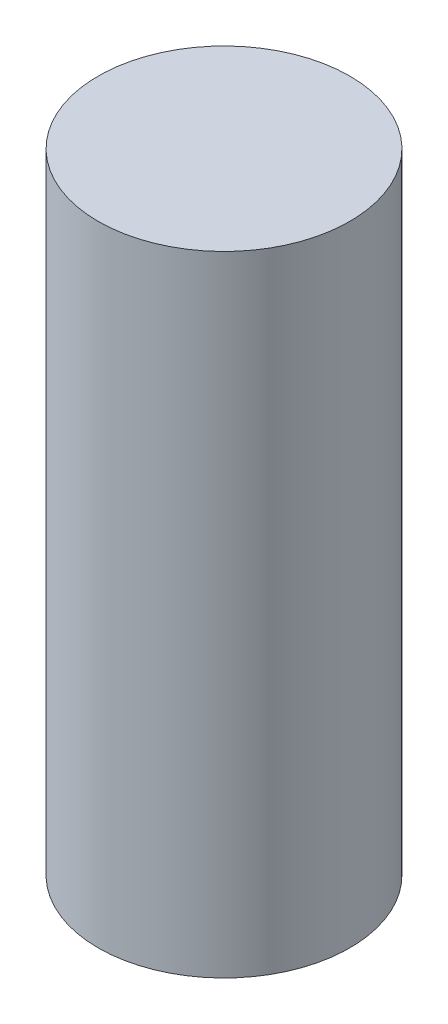
from build123d import *

# Parameters (mm, degrees)
SKETCH_1_R      = 300
EXTRUDE_1_DEPTH = 1500


with BuildPart() as part:
    # 草图1 → 凸台-拉伸1 (new body)
    with BuildSketch(Plane(origin=(0, 0, 0), x_dir=(1, 0, 0), z_dir=(0, 1, 0))):
        Circle(SKETCH_1_R)
    extrude(amount=EXTRUDE_1_DEPTH)


solid = part.part
